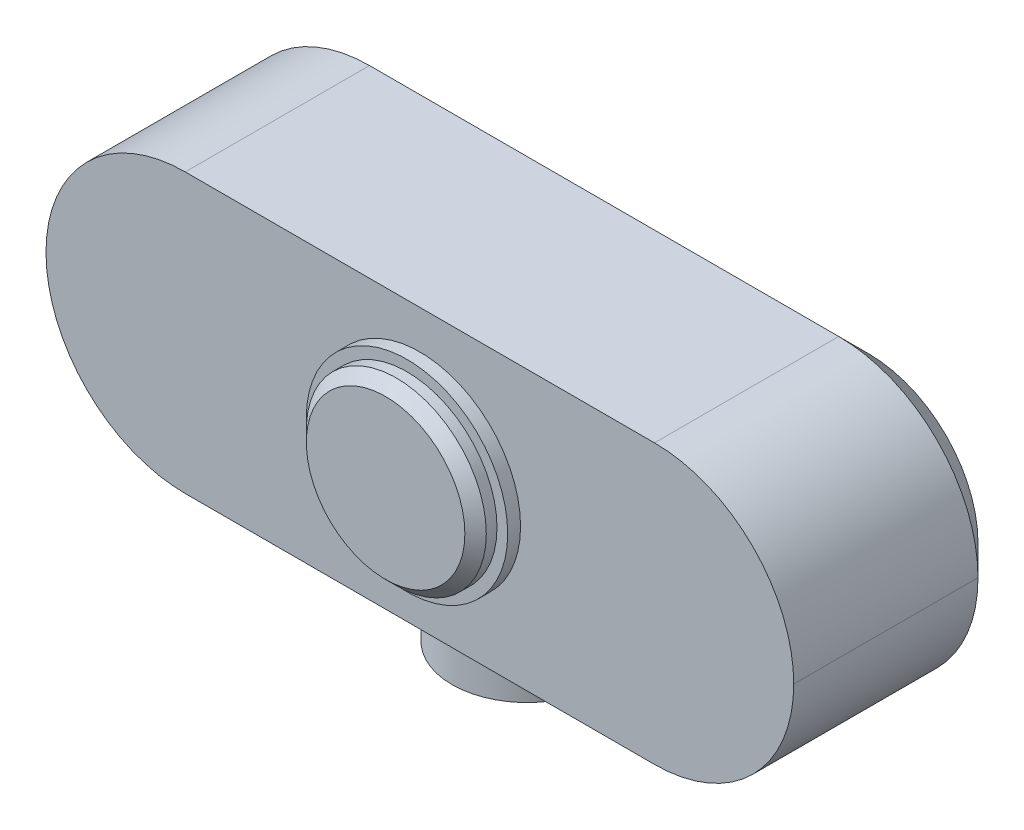
from build123d import *

# Parameters (mm, degrees)
SKETCH1_W           = 69.8
SKETCH1_H           = 26
BOSS_EXTRUDE1_DEPTH = 20
FILLET1_R           = 13
SKETCH2_R           = 9.4
BOSS_EXTRUDE2_DEPTH = 1.2
SKETCH3_R           = 8.4
BOSS_EXTRUDE3_DEPTH = 2
CHAMFER1_SIZE       = 1
SKETCH4_R           = 7
SKETCH4_R_2         = 5
BOSS_EXTRUDE4_DEPTH = 6
SKETCH5_R           = 1.75
BOSS_EXTRUDE5_DEPTH = 5
CHAMFER2_SIZE       = 2.8
CUT_EXTRUDE1_START  = -1
SKETCH6_R           = 1.75
CUT_EXTRUDE1_DEPTH  = 1


with BuildPart() as part:
    # Sketch1 → Boss-Extrude1 (new body)
    with BuildSketch(Plane.XY):
        Rectangle(SKETCH1_W, SKETCH1_H)
    extrude(amount=BOSS_EXTRUDE1_DEPTH)

    # Fillet1
    fillet1_edges = [part.edges().sort_by_distance(p)[0] for p in [
        (-34.9, -13, 10),
        (-34.9, 13, 10),
        (34.9, -13, 10),
        (34.9, 13, 10),
    ]]
    fillet(fillet1_edges, radius=FILLET1_R - 0.0001)  # a hair under: the kernel refuses the full size

    # Sketch2 → Boss-Extrude2 (add)
    with BuildSketch(Plane.XY.offset(20)):
        Circle(SKETCH2_R)
    extrude(amount=BOSS_EXTRUDE2_DEPTH)

    # Sketch3 → Boss-Extrude3 (add)
    with BuildSketch(Plane.XY.offset(21.2)):
        Circle(SKETCH3_R)
    extrude(amount=BOSS_EXTRUDE3_DEPTH)

    # Chamfer1
    chamfer1_edges = [part.edges().sort_by_distance(p)[0] for p in [
        (-8.4, 0, 23.2),
    ]]
    chamfer(chamfer1_edges, length=CHAMFER1_SIZE)

    # Sketch4 → Boss-Extrude4 (add)
    with BuildSketch(Plane.XZ.offset(13)):
        with Locations(Location((0, 10, 0), (0, 0, 180))):
            Circle(SKETCH4_R)
        with Locations((0, 10)):
            Circle(SKETCH4_R_2, mode=Mode.SUBTRACT)
    extrude(amount=BOSS_EXTRUDE4_DEPTH)

    # Sketch5 → Boss-Extrude5 (add)
    with BuildSketch(Plane(origin=(0, 0, 0), x_dir=(-1, 0, 0), z_dir=(0, 0, -1))):
        with Locations(Location((-18.9, -8, 0), (0, 0, 180))):
            Circle(SKETCH5_R)
    extrude(amount=BOSS_EXTRUDE5_DEPTH)

    # Chamfer2
    chamfer2_edges = [part.edges().sort_by_distance(p)[0] for p in [
        (0, -13, 0),
        (0, 13, 0),
        (31.092417445, 9.192417445, 0),
        (31.092417445, -9.192417445, 0),
        (-31.092417445, 9.192417445, 0),
        (-31.092417445, -9.192417445, 0),
    ]]
    chamfer(chamfer2_edges, length=CHAMFER2_SIZE)

    # Sketch6 → Cut-Extrude1 (cut)
    with BuildSketch(Plane(origin=(0, 0, 0), x_dir=(-1, 0, 0), z_dir=(0, 0, -1)).offset(CUT_EXTRUDE1_START)):
        with BuildLine():
            Line((-21.4, -10.2), (-21.4, -8))
            ThreePointArc((-21.4, -8), (-18.9, -5.5), (-16.4, -8))
            Line((-16.4, -8), (-16.4, -10.2))
            Line((-16.4, -10.2), (-21.4, -10.2))
        make_face()
        with Locations((-18.9, -8)):
            Circle(SKETCH6_R, mode=Mode.SUBTRACT)
    extrude(amount=CUT_EXTRUDE1_DEPTH, mode=Mode.SUBTRACT)


solid = part.part
